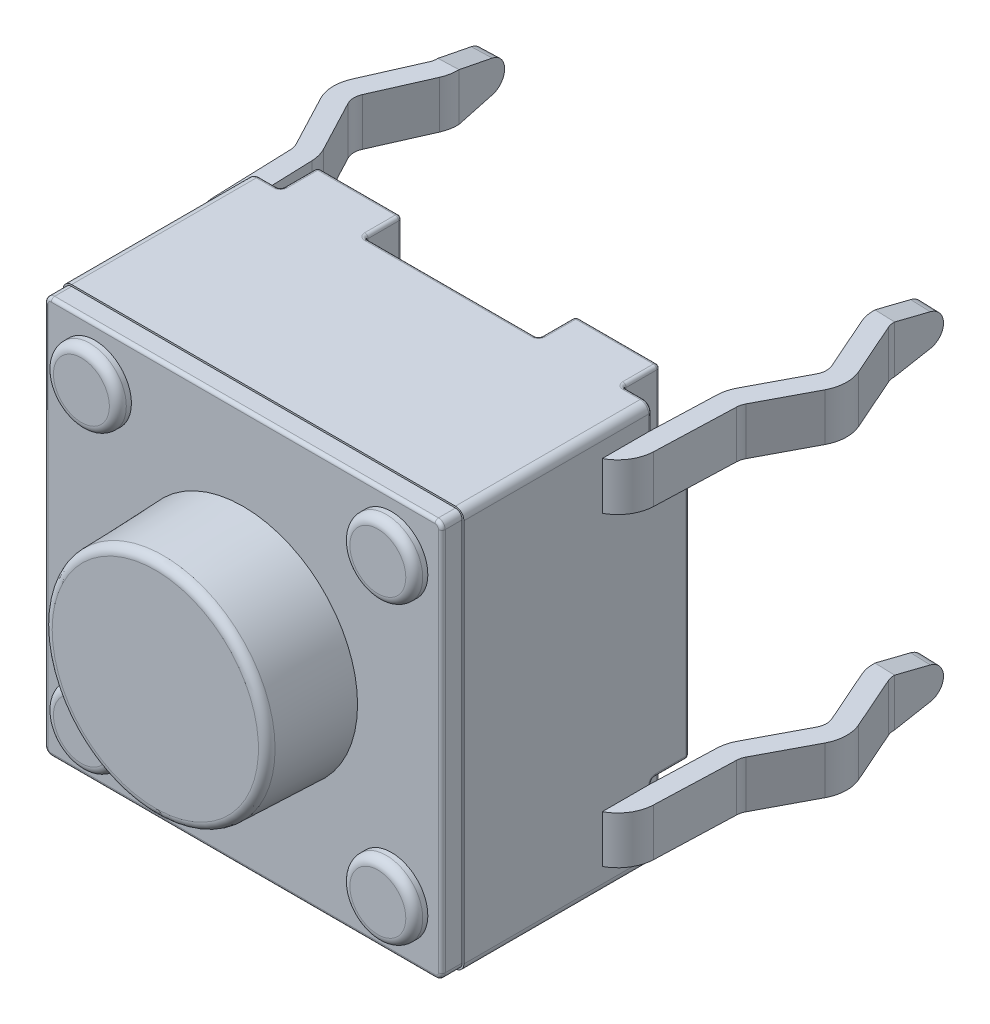
from build123d import *

# Parameters (mm, degrees)
BOSS_EXTRUDE1_START  = 0.5588
SKETCH1_W            = 6.0071
SKETCH1_H            = 6.0071
BOSS_EXTRUDE1_DEPTH  = 2.8194
FILLET1_R            = 0.127
BOSS_EXTRUDE2_DEPTH  = 0.3048
BOSS_EXTRUDE3_REACH  = 7.622
SKETCH4_R            = 0.5461
BOSS_EXTRUDE4_DEPTH  = 0.2032
SKETCH5_R            = 1.7145
BOSS_EXTRUDE5_DEPTH  = 1.317
BOSS_EXTRUDE5_TAPER  = 2
FILLET2_R            = 0.127
FILLET3_R            = 0.0508
EXTRUDE_THIN1_START  = -0.3556
EXTRUDE_THIN1_DEPTH  = 0.7112
CUT_EXTRUDE1_DEPTH   = 0.7112
MIRROR3_START        = -0.3556
MIRROR3_COPY_1_DEPTH = 0.7112
MIRROR3_COPY_2_DEPTH = 0.7112


with BuildPart() as part:
    # Sketch1 → Boss-Extrude1 (new body)
    with BuildSketch(Plane.XY.offset(BOSS_EXTRUDE1_START)):
        Rectangle(SKETCH1_W, SKETCH1_H)
    extrude(amount=BOSS_EXTRUDE1_DEPTH)

    # Fillet1
    fillet1_edges = [part.edges().sort_by_distance(p)[0] for p in [
        (3.00355, -3.00355, 1.9685),
        (-3.00355, -3.00355, 1.9685),
        (-3.00355, 3.00355, 1.9685),
        (3.00355, 3.00355, 1.9685),
    ]]
    fillet(fillet1_edges, radius=FILLET1_R)

    # Sketch2 → Boss-Extrude2 (add)
    with BuildSketch(Plane(origin=(0, 0, 3.3782), x_dir=(-1, 0, 0), z_dir=(0, 0, -1))):
        with BuildLine():
            Line((2.97815, -2.87655), (2.97815, 2.87655))
            ThreePointArc((2.97815, 2.87655), (2.948392049, 2.948392049), (2.87655, 2.97815))
            Line((2.87655, 2.97815), (-2.87655, 2.97815))
            ThreePointArc((-2.87655, 2.97815), (-2.948392049, 2.948392049), (-2.97815, 2.87655))
            Line((-2.97815, 2.87655), (-2.97815, -2.87655))
            ThreePointArc((-2.97815, -2.87655), (-2.948392049, -2.948392049), (-2.87655, -2.97815))
            Line((-2.87655, -2.97815), (2.87655, -2.97815))
            ThreePointArc((2.87655, -2.97815), (2.948392049, -2.948392049), (2.97815, -2.87655))
        make_face()
    extrude(amount=-BOSS_EXTRUDE2_DEPTH)

    # Sketch3 → Boss-Extrude3 (add, up to next)
    with BuildSketch(Plane.XY, mode=Mode.PRIVATE) as boss_extrude3_sk1:
        Polygon((-2.566197678, -3.00355), (-2.566197678, -1.89483443), (-3.00355, -1.89483443), (-3.00355, 1.89483443), (-2.566197678, 1.89483443), (-2.566197678, 3.00355), (-1.30175, 3.00355), (-1.30175, 0.560941661), (-2.441300776, 0.560941661), (-2.441300776, -0.560941661), (-1.30175, -0.560941661), (-1.30175, -3.00355), align=None)
    boss_extrude3_tool1 = extrude(boss_extrude3_sk1.sketch, amount=BOSS_EXTRUDE3_REACH, mode=Mode.PRIVATE) - part.part
    # Sketch3 → Boss-Extrude3 (add, up to next)
    with BuildSketch(Plane.XY, mode=Mode.PRIVATE) as boss_extrude3_sk2:
        Polygon((2.566197678, 3.00355), (2.566197678, 1.89483443), (3.00355, 1.89483443), (3.00355, -1.89483443), (2.566197678, -1.89483443), (2.566197678, -3.00355), (1.30175, -3.00355), (1.30175, -0.560941661), (2.441300776, -0.560941661), (2.441300776, 0.560941661), (1.30175, 0.560941661), (1.30175, 3.00355), align=None)
    boss_extrude3_tool2 = extrude(boss_extrude3_sk2.sketch, amount=BOSS_EXTRUDE3_REACH, mode=Mode.PRIVATE) - part.part
    add(boss_extrude3_tool1.solids().sort_by_distance((-2.503763, -2.449192, 0))[0])
    add(boss_extrude3_tool2.solids().sort_by_distance((2.503763, 2.449192, 0))[0])

    # Sketch4 → Boss-Extrude4 (add)
    with BuildSketch(Plane.XY.offset(3.683)):
        with Locations(Location((2.221694311, 2.212885437, 0), (0, 0, 90))):
            Circle(SKETCH4_R)
        with Locations(Location((-2.221694311, 2.212885437, 0), (0, 0, 90))):
            Circle(SKETCH4_R)
        with Locations(Location((-2.221694311, -2.212885437, 0), (0, 0, 90))):
            Circle(SKETCH4_R)
        with Locations(Location((2.221694311, -2.212885437, 0), (0, 0, 90))):
            Circle(SKETCH4_R)
    extrude(amount=BOSS_EXTRUDE4_DEPTH)

    # Sketch5 → Boss-Extrude5 (add)
    with BuildSketch(Plane.XY.offset(3.683)):
        Circle(SKETCH5_R)
    extrude(amount=BOSS_EXTRUDE5_DEPTH, taper=BOSS_EXTRUDE5_TAPER)

    # Fillet2
    fillet2_edges = [part.edges().sort_by_distance(p)[0] for p in [
        (2.221694311, 1.666785437, 3.8862),
        (-2.221694311, 1.666785437, 3.8862),
        (-2.221694311, -2.758985437, 3.8862),
        (2.221694311, -2.758985437, 3.8862),
        (-1.668509347, 0, 5),
    ]]
    fillet(fillet2_edges, radius=FILLET2_R)

    # Fillet3
    fillet3_edges = [part.edges().sort_by_distance(p)[0] for p in [
        (1.30175, 1.782245831, 0.5588),
        (1.30175, 3.00355, 0.2794),
        (1.30175, 1.782245831, 0),
        (1.871525388, 0.560941661, 0.5588),
        (1.30175, 0.560941661, 0.2794),
        (1.871525388, 0.560941661, 0),
        (2.441300776, 0, 0.5588),
        (2.441300776, 0.560941661, 0.2794),
        (2.441300776, 0, 0),
        (1.871525388, -0.560941661, 0.5588),
        (2.441300776, -0.560941661, 0.2794),
        (1.871525388, -0.560941661, 0),
        (1.30175, -1.782245831, 0.5588),
        (1.30175, -0.560941661, 0.2794),
        (1.30175, -1.782245831, 0),
        (1.30175, -3.00355, 0.2794),
        (1.933973839, -3.00355, 0),
        (2.566197678, -2.449192215, 0.5588),
        (2.566197678, -3.00355, 0.2794),
        (2.566197678, -2.449192215, 0),
        (2.784873839, -1.89483443, 0.5588),
        (2.566197678, -1.89483443, 0.2794),
        (2.784873839, -1.89483443, 0),
        (3.00355, -1.89483443, 0.2794),
        (3.00355, 0, 0),
        (2.784873839, 1.89483443, 0.5588),
        (3.00355, 1.89483443, 0.2794),
        (2.784873839, 1.89483443, 0),
        (2.566197678, 3.00355, 0.2794),
        (1.933973839, 3.00355, 0),
        (2.566197678, 2.449192215, 0.5588),
        (2.566197678, 1.89483443, 0.2794),
        (2.566197678, 2.449192215, 0),
        (-2.721373839, -3.00355, 0.5588),
        (3.00355, -2.385692215, 0.5588),
        (-3.00355, 2.385692215, 0.5588),
        (2.721373839, 3.00355, 0.5588),
        (2.966352561, -2.966352561, 0.5588),
        (2.966352561, 2.966352561, 0.5588),
        (-2.966352561, 2.966352561, 0.5588),
        (-2.966352561, -2.966352561, 0.5588),
        (-2.948392049, -2.948392049, 3.683),
        (0, -2.97815, 3.683),
        (2.948392049, -2.948392049, 3.683),
        (2.97815, 0, 3.683),
        (2.948392049, 2.948392049, 3.683),
        (0, 2.97815, 3.683),
        (-2.948392049, 2.948392049, 3.683),
        (-2.97815, 0, 3.683),
        (0, -3.00355, 0.5588),
        (-3.00355, -2.385692215, 0.5588),
        (-2.721373839, 3.00355, 0.5588),
        (-1.30175, -1.782245831, 0.5588),
        (-1.30175, -3.00355, 0.2794),
        (-1.30175, -1.782245831, 0),
        (-1.871525388, -0.560941661, 0.5588),
        (-1.30175, -0.560941661, 0.2794),
        (-1.871525388, -0.560941661, 0),
        (-2.441300776, 0, 0.5588),
        (-2.441300776, -0.560941661, 0.2794),
        (-2.441300776, 0, 0),
        (-1.871525388, 0.560941661, 0.5588),
        (-2.441300776, 0.560941661, 0.2794),
        (-1.871525388, 0.560941661, 0),
        (-1.30175, 1.782245831, 0.5588),
        (-1.30175, 0.560941661, 0.2794),
        (-1.30175, 1.782245831, 0),
        (-1.30175, 3.00355, 0.2794),
        (-1.933973839, 3.00355, 0),
        (-2.566197678, 2.449192215, 0.5588),
        (-2.566197678, 3.00355, 0.2794),
        (-2.566197678, 2.449192215, 0),
        (-2.784873839, 1.89483443, 0.5588),
        (-2.566197678, 1.89483443, 0.2794),
        (-2.784873839, 1.89483443, 0),
        (-3.00355, 1.89483443, 0.2794),
        (-3.00355, 0, 0),
        (-2.784873839, -1.89483443, 0.5588),
        (-3.00355, -1.89483443, 0.2794),
        (-2.784873839, -1.89483443, 0),
        (-2.566197678, -3.00355, 0.2794),
        (-1.933973839, -3.00355, 0),
        (-2.566197678, -2.449192215, 0.5588),
        (-2.566197678, -1.89483443, 0.2794),
        (-2.566197678, -2.449192215, 0),
        (0, 3.00355, 0.5588),
        (3.00355, 2.385692215, 0.5588),
        (2.721373839, -3.00355, 0.5588),
    ]]
    fillet(fillet3_edges, radius=FILLET3_R)

    # Sketch6 → Extrude-Thin1 (add)
    with BuildSketch(Plane.XZ.offset(3.00355).offset(EXTRUDE_THIN1_START)):
        with BuildLine():
            Line((-2.526489479, 1.064092226), (-2.74199854, 1.064092226))
            ThreePointArc((-2.74199854, 1.064092226), (-2.918441767, 0.992804535), (-2.995843811, 0.818956698))
            Line((-2.995843811, 0.818956698), (-3.03780929, -0.382777412))
            ThreePointArc((-3.03780929, -0.382777412), (-3.056264298, -0.506985303), (-3.10198813, -0.623936226))
            Line((-3.10198813, -0.623936226), (-3.511410555, -1.400308198))
            ThreePointArc((-3.511410555, -1.400308198), (-3.540582755, -1.509925841), (-3.519128157, -1.62131141))
            Line((-3.519128157, -1.62131141), (-3.164860036, -2.424352043))
            ThreePointArc((-3.164860036, -2.424352043), (-3.127405669, -2.544207613), (-3.117659921, -2.669400296))
            Line((-3.117659921, -2.669400296), (-3.142411752, -3.3782))
            Line((-3.142411752, -3.3782), (-3.447026076, -3.367562633))
            Line((-3.447026076, -3.367562633), (-3.422274245, -2.658762929))
            ThreePointArc((-3.422274245, -2.658762929), (-3.42670413, -2.601857165), (-3.443728843, -2.54737736))
            Line((-3.443728843, -2.54737736), (-3.797996964, -1.744336727))
            ThreePointArc((-3.797996964, -1.744336727), (-3.845197079, -1.499288474), (-3.781018239, -1.25812966))
            Line((-3.781018239, -1.25812966), (-3.371595814, -0.481757688))
            ThreePointArc((-3.371595814, -0.481757688), (-3.350812254, -0.428598178), (-3.342423614, -0.372140046))
            Line((-3.342423614, -0.372140046), (-3.300458135, 0.829594065))
            ThreePointArc((-3.300458135, 0.829594065), (-3.130173638, 1.212059307), (-2.74199854, 1.368892226))
            Line((-2.74199854, 1.368892226), (-2.526489479, 1.368892226))
            Line((-2.526489479, 1.368892226), (-2.526489479, 1.064092226))
        make_face()
    extrude_thin1 = extrude(amount=-EXTRUDE_THIN1_DEPTH)

    # Sketch9 → Cut-Extrude1 (cut)
    with BuildSketch(Plane(origin=(-3.325373038, 0, 0.116124585), x_dir=(0.03489949670250484, 0, 0.9993908270190957), z_dir=(-0.9993908270190955, 0, 0.034899496702504834))):
        with BuildLine():
            Line((-3.48581068, -2.64795), (-2.776578932, -2.64795))
            Line((-2.776578932, -2.64795), (-3.294397493, -2.531561906))
            ThreePointArc((-3.294397493, -2.531561906), (-3.432067064, -2.445533994), (-3.48581068, -2.29235))
            Line((-3.48581068, -2.29235), (-3.48581068, -2.64795))
        make_face()
        with BuildLine():
            Line((-3.48581068, -1.93675), (-3.48581068, -2.29235))
            ThreePointArc((-3.48581068, -2.29235), (-3.432067064, -2.139166006), (-3.294397493, -2.053138094))
            Line((-3.294397493, -2.053138094), (-2.776578932, -1.93675))
            Line((-2.776578932, -1.93675), (-3.48581068, -1.93675))
        make_face()
    cut_extrude1 = extrude(amount=-CUT_EXTRUDE1_DEPTH, mode=Mode.SUBTRACT)

    # Mirror1: Extrude-Thin1, Cut-Extrude1 across plane
    add(extrude_thin1.mirror(Plane.ZX))
    add(cut_extrude1.mirror(Plane.ZX), mode=Mode.SUBTRACT)

    # Mirror3: Extrude-Thin1, Cut-Extrude1 across plane
    add(extrude_thin1.mirror(Plane(origin=(0, 0, 0), x_dir=(0, 0, 1), z_dir=(1, 0, 0))))
    add(cut_extrude1.mirror(Plane(origin=(0, 0, 0), x_dir=(0, 0, 1), z_dir=(1, 0, 0))), mode=Mode.SUBTRACT)

    # Mirror3 copy 1 sketch → Mirror3 copy 1 (add)
    with BuildSketch(Plane(origin=(0, 3.00355, 0), x_dir=(-1, 0, 0), z_dir=(0, 1, 0)).offset(MIRROR3_START)):
        with BuildLine():
            Line((-2.526489479, 1.064092226), (-2.74199854, 1.064092226))
            ThreePointArc((-2.74199854, 1.064092226), (-2.918441767, 0.992804535), (-2.995843811, 0.818956698))
            Line((-2.995843811, 0.818956698), (-3.03780929, -0.382777412))
            ThreePointArc((-3.03780929, -0.382777412), (-3.056264298, -0.506985303), (-3.10198813, -0.623936226))
            Line((-3.10198813, -0.623936226), (-3.511410555, -1.400308198))
            ThreePointArc((-3.511410555, -1.400308198), (-3.540582755, -1.509925841), (-3.519128157, -1.62131141))
            Line((-3.519128157, -1.62131141), (-3.164860036, -2.424352043))
            ThreePointArc((-3.164860036, -2.424352043), (-3.127405669, -2.544207613), (-3.117659921, -2.669400296))
            Line((-3.117659921, -2.669400296), (-3.142411752, -3.3782))
            Line((-3.142411752, -3.3782), (-3.447026076, -3.367562633))
            Line((-3.447026076, -3.367562633), (-3.422274245, -2.658762929))
            ThreePointArc((-3.422274245, -2.658762929), (-3.42670413, -2.601857165), (-3.443728843, -2.54737736))
            Line((-3.443728843, -2.54737736), (-3.797996964, -1.744336727))
            ThreePointArc((-3.797996964, -1.744336727), (-3.845197079, -1.499288474), (-3.781018239, -1.25812966))
            Line((-3.781018239, -1.25812966), (-3.371595814, -0.481757688))
            ThreePointArc((-3.371595814, -0.481757688), (-3.350812254, -0.428598178), (-3.342423614, -0.372140046))
            Line((-3.342423614, -0.372140046), (-3.300458135, 0.829594065))
            ThreePointArc((-3.300458135, 0.829594065), (-3.130173638, 1.212059307), (-2.74199854, 1.368892226))
            Line((-2.74199854, 1.368892226), (-2.526489479, 1.368892226))
            Line((-2.526489479, 1.368892226), (-2.526489479, 1.064092226))
        make_face()
    extrude(amount=-MIRROR3_COPY_1_DEPTH)

    # Mirror3 copy 2 sketch → Mirror3 copy 2 (cut)
    with BuildSketch(Plane(origin=(3.325373038, 0, 0.116124585), x_dir=(-0.03489949670250484, 0, 0.9993908270190957), z_dir=(0.9993908270190955, 0, 0.034899496702504834))):
        with BuildLine():
            Line((-3.48581068, -2.64795), (-2.776578932, -2.64795))
            Line((-2.776578932, -2.64795), (-3.294397493, -2.531561906))
            ThreePointArc((-3.294397493, -2.531561906), (-3.432067064, -2.445533994), (-3.48581068, -2.29235))
            Line((-3.48581068, -2.29235), (-3.48581068, -2.64795))
        make_face()
        with BuildLine():
            Line((-3.48581068, -1.93675), (-3.48581068, -2.29235))
            ThreePointArc((-3.48581068, -2.29235), (-3.432067064, -2.139166006), (-3.294397493, -2.053138094))
            Line((-3.294397493, -2.053138094), (-2.776578932, -1.93675))
            Line((-2.776578932, -1.93675), (-3.48581068, -1.93675))
        make_face()
    extrude(amount=-MIRROR3_COPY_2_DEPTH, mode=Mode.SUBTRACT)


solid = part.part
